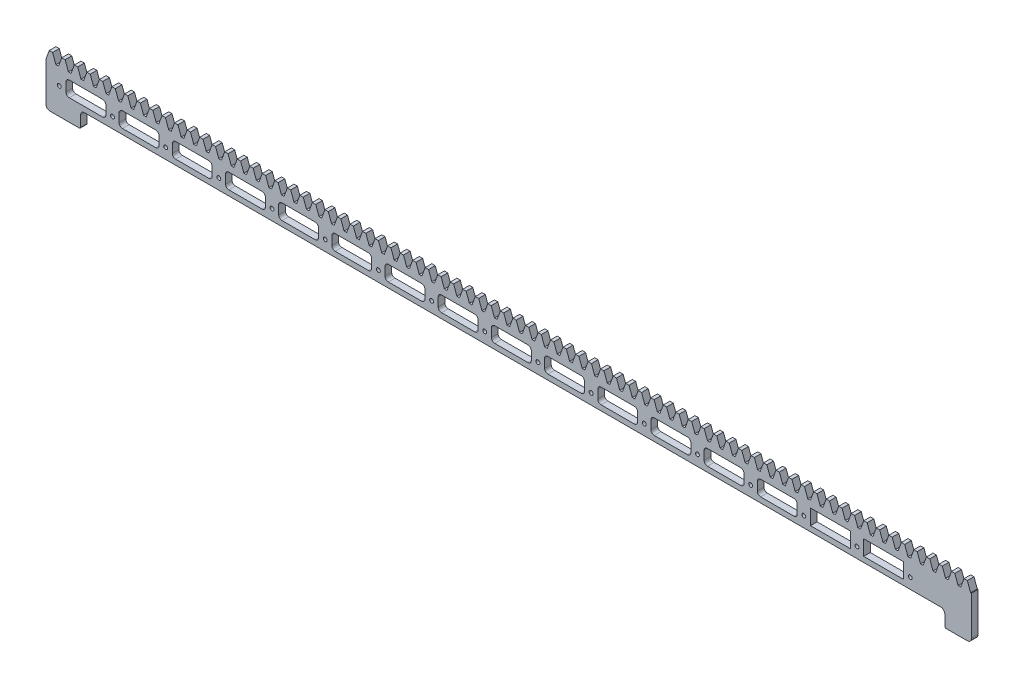
from build123d import *

# Parameters (mm, degrees)
SKETCH_1_W             = 695
SKETCH_1_H             = 20.5
EXTRUDE_1_DEPTH        = 5
EXTRUDE_2_DEPTH        = 5
PATTERN_LINEAR_1_COUNT = 74
PATTERN_LINEAR_1_PITCH = 9.42477795
SKETCH_3_R             = 1.45
CUT_EXTRUDE_1_DEPTH    = 696.770998472
CUT_EXTRUDE_START      = -10
SKETCH_5_R             = 1.45
CUT_EXTRUDE_2_DEPTH    = 10
SKETCH_10_W            = 30
SKETCH_10_H            = 11.5
CUT_EXTRUDE_4_DEPTH    = 696.770998472
FILLET_1_R             = 2.5
SKETCH_11_W            = 26
SKETCH_11_H            = 12
EXTRUDE_1_2_DEPTH      = 5
SKETCH_12_W            = 20
SKETCH_12_H            = 32.5
EXTRUDE_2_2_DEPTH      = 5
FILLET_2_R             = 3
FILLET_3_R             = 1
CUT_EXTRUDE_3_DEPTH    = 2


with BuildPart() as part:
    # 草图1 → Extrude 1 (new body)
    with BuildSketch(Plane.XY):
        with Locations((347.5, -10.25)):
            Rectangle(SKETCH_1_W, SKETCH_1_H)
    extrude(amount=EXTRUDE_1_DEPTH)

    # 草图2 → Extrude 2 (add)
    with BuildSketch(Plane.XY.offset(5)):
        Polygon((0, 0), (2.456799081, 6.75), (4.985366651, 6.75), (7.442165732, 0), align=None)
    extrude_2 = extrude(amount=-EXTRUDE_2_DEPTH)

    # 阵列(线性)1: Extrude 2 ×74
    with Locations(*[(i * PATTERN_LINEAR_1_PITCH, 0, 0) for i in range(1, PATTERN_LINEAR_1_COUNT)]):
        add(extrude_2)

    # 草图3 → 切除-拉伸1 (cut, through all)
    with BuildSketch(Plane.XY):
        with Locations((10, -12.5)):
            Circle(SKETCH_3_R)
    extrude(amount=CUT_EXTRUDE_1_DEPTH, mode=Mode.SUBTRACT)

    # 草图5 → 切除-拉伸2 (cut)
    with BuildSketch(Plane.XY.offset(5).offset(CUT_EXTRUDE_START)):
        with Locations((10, -12.5)):
            Circle(SKETCH_5_R)
        with Locations((50, -12.5)):
            Circle(SKETCH_5_R)
        with Locations((90, -12.5)):
            Circle(SKETCH_5_R)
        with Locations((130, -12.5)):
            Circle(SKETCH_5_R)
        with Locations((170, -12.5)):
            Circle(SKETCH_5_R)
        with Locations((210, -12.5)):
            Circle(SKETCH_5_R)
        with Locations((250, -12.5)):
            Circle(SKETCH_5_R)
        with Locations((290, -12.5)):
            Circle(SKETCH_5_R)
        with Locations((330, -12.5)):
            Circle(SKETCH_5_R)
        with Locations((370, -12.5)):
            Circle(SKETCH_5_R)
        with Locations((410, -12.5)):
            Circle(SKETCH_5_R)
        with Locations((450, -12.5)):
            Circle(SKETCH_5_R)
        with Locations((490, -12.5)):
            Circle(SKETCH_5_R)
        with Locations((530, -12.5)):
            Circle(SKETCH_5_R)
        with Locations((570, -12.5)):
            Circle(SKETCH_5_R)
        with Locations((610, -12.5)):
            Circle(SKETCH_5_R)
        with Locations((650, -12.5)):
            Circle(SKETCH_5_R)
    extrude(amount=CUT_EXTRUDE_2_DEPTH, mode=Mode.SUBTRACT)

    # 草图10 → 切除-拉伸4 (cut, through all)
    with BuildSketch(Plane.XY.offset(5)):
        with Locations((30, -10.75)):
            Rectangle(SKETCH_10_W, SKETCH_10_H)
        with Locations((70, -10.75)):
            Rectangle(SKETCH_10_W, SKETCH_10_H)
        with Locations((110, -10.75)):
            Rectangle(SKETCH_10_W, SKETCH_10_H)
        with Locations((150, -10.75)):
            Rectangle(SKETCH_10_W, SKETCH_10_H)
        with Locations((190, -10.75)):
            Rectangle(SKETCH_10_W, SKETCH_10_H)
        with Locations((230, -10.75)):
            Rectangle(SKETCH_10_W, SKETCH_10_H)
        with Locations((270, -10.75)):
            Rectangle(SKETCH_10_W, SKETCH_10_H)
        with Locations((310, -10.75)):
            Rectangle(SKETCH_10_W, SKETCH_10_H)
        with Locations((350, -10.75)):
            Rectangle(SKETCH_10_W, SKETCH_10_H)
        with Locations((390, -10.75)):
            Rectangle(SKETCH_10_W, SKETCH_10_H)
        with Locations((430, -10.75)):
            Rectangle(SKETCH_10_W, SKETCH_10_H)
        with Locations((470, -10.75)):
            Rectangle(SKETCH_10_W, SKETCH_10_H)
        with Locations((510, -10.75)):
            Rectangle(SKETCH_10_W, SKETCH_10_H)
        with Locations((550, -10.75)):
            Rectangle(SKETCH_10_W, SKETCH_10_H)
        with Locations((590, -10.75)):
            Rectangle(SKETCH_10_W, SKETCH_10_H)
        with Locations((630, -10.75)):
            Rectangle(SKETCH_10_W, SKETCH_10_H)
    extrude(amount=-CUT_EXTRUDE_4_DEPTH, mode=Mode.SUBTRACT)

    # 圆角1
    fillet_1_edges = [part.edges().sort_by_distance(p)[0] for p in [
        (15, -16.5, 2.5),
        (15, -5, 2.5),
        (45, -5, 2.5),
        (45, -16.5, 2.5),
        (55, -16.5, 2.5),
        (55, -5, 2.5),
        (85, -5, 2.5),
        (85, -16.5, 2.5),
        (95, -16.5, 2.5),
        (95, -5, 2.5),
        (125, -5, 2.5),
        (125, -16.5, 2.5),
        (135, -16.5, 2.5),
        (135, -5, 2.5),
        (165, -5, 2.5),
        (165, -16.5, 2.5),
        (175, -16.5, 2.5),
        (175, -5, 2.5),
        (205, -5, 2.5),
        (205, -16.5, 2.5),
        (215, -16.5, 2.5),
        (215, -5, 2.5),
        (245, -5, 2.5),
        (245, -16.5, 2.5),
        (255, -16.5, 2.5),
        (255, -5, 2.5),
        (285, -5, 2.5),
        (285, -16.5, 2.5),
        (295, -16.5, 2.5),
        (295, -5, 2.5),
        (325, -5, 2.5),
        (325, -16.5, 2.5),
        (335, -16.5, 2.5),
        (335, -5, 2.5),
        (365, -5, 2.5),
        (365, -16.5, 2.5),
        (375, -16.5, 2.5),
        (375, -5, 2.5),
        (405, -5, 2.5),
        (405, -16.5, 2.5),
        (415, -16.5, 2.5),
        (415, -5, 2.5),
        (445, -5, 2.5),
        (445, -16.5, 2.5),
        (455, -16.5, 2.5),
        (455, -5, 2.5),
        (485, -5, 2.5),
        (485, -16.5, 2.5),
        (495, -16.5, 2.5),
        (495, -5, 2.5),
        (525, -5, 2.5),
        (525, -16.5, 2.5),
        (535, -16.5, 2.5),
        (535, -5, 2.5),
        (565, -5, 2.5),
        (565, -16.5, 2.5),
    ]]
    fillet(fillet_1_edges, radius=FILLET_1_R)

    # 草图11 → Extrude 1 2 (add)
    with BuildSketch(Plane.XY):
        with Locations((13, -26.5)):
            Rectangle(SKETCH_11_W, SKETCH_11_H)
    extrude(amount=EXTRUDE_1_2_DEPTH)

    # 草图12 → Extrude 2 2 (add)
    with BuildSketch(Plane.XY):
        with Locations((686, -16.25)):
            Rectangle(SKETCH_12_W, SKETCH_12_H)
    extrude(amount=EXTRUDE_2_2_DEPTH)

    # 圆角2
    fillet_2_edges = [part.edges().sort_by_distance(p)[0] for p in [
        (26, -20.5, 2.5),
        (0, -32.5, 2.5),
        (676, -20.5, 2.5),
        (696, -32.5, 2.5),
    ]]
    fillet(fillet_2_edges, radius=FILLET_2_R)

    # 圆角3
    fillet_3_edges = [part.edges().sort_by_distance(p)[0] for p in [
        (26, -32.5, 2.5),
        (676, -32.5, 2.5),
    ]]
    fillet(fillet_3_edges, radius=FILLET_3_R)

    # 草图6 → 切除-拉伸3 (cut)
    with BuildSketch(Plane.XY.offset(5)):
        with BuildLine():
            Line((6, -5.5), (14, -5.5))
            ThreePointArc((14, -5.5), (17, -8.5), (14, -11.5))
            Line((14, -11.5), (6, -11.5))
            ThreePointArc((6, -11.5), (3, -8.5), (6, -5.5))
        make_face()
        with BuildLine():
            Line((46, -5.5), (54, -5.5))
            ThreePointArc((54, -5.5), (57, -8.5), (54, -11.5))
            Line((54, -11.5), (46, -11.5))
            ThreePointArc((46, -11.5), (43, -8.5), (46, -5.5))
        make_face()
        with BuildLine():
            Line((86, -5.5), (94, -5.5))
            ThreePointArc((94, -5.5), (97, -8.5), (94, -11.5))
            Line((94, -11.5), (86, -11.5))
            ThreePointArc((86, -11.5), (83, -8.5), (86, -5.5))
        make_face()
        with BuildLine():
            Line((126, -5.5), (134, -5.5))
            ThreePointArc((134, -5.5), (137, -8.5), (134, -11.5))
            Line((134, -11.5), (126, -11.5))
            ThreePointArc((126, -11.5), (123, -8.5), (126, -5.5))
        make_face()
        with BuildLine():
            Line((166, -5.5), (174, -5.5))
            ThreePointArc((174, -5.5), (177, -8.5), (174, -11.5))
            Line((174, -11.5), (166, -11.5))
            ThreePointArc((166, -11.5), (163, -8.5), (166, -5.5))
        make_face()
        with BuildLine():
            Line((206, -5.5), (214, -5.5))
            ThreePointArc((214, -5.5), (217, -8.5), (214, -11.5))
            Line((214, -11.5), (206, -11.5))
            ThreePointArc((206, -11.5), (203, -8.5), (206, -5.5))
        make_face()
        with BuildLine():
            Line((246, -5.5), (254, -5.5))
            ThreePointArc((254, -5.5), (257, -8.5), (254, -11.5))
            Line((254, -11.5), (246, -11.5))
            ThreePointArc((246, -11.5), (243, -8.5), (246, -5.5))
        make_face()
        with BuildLine():
            Line((286, -5.5), (294, -5.5))
            ThreePointArc((294, -5.5), (297, -8.5), (294, -11.5))
            Line((294, -11.5), (286, -11.5))
            ThreePointArc((286, -11.5), (283, -8.5), (286, -5.5))
        make_face()
        with BuildLine():
            Line((326, -5.5), (334, -5.5))
            ThreePointArc((334, -5.5), (337, -8.5), (334, -11.5))
            Line((334, -11.5), (326, -11.5))
            ThreePointArc((326, -11.5), (323, -8.5), (326, -5.5))
        make_face()
        with BuildLine():
            Line((366, -5.5), (374, -5.5))
            ThreePointArc((374, -5.5), (377, -8.5), (374, -11.5))
            Line((374, -11.5), (366, -11.5))
            ThreePointArc((366, -11.5), (363, -8.5), (366, -5.5))
        make_face()
        with BuildLine():
            Line((406, -5.5), (414, -5.5))
            ThreePointArc((414, -5.5), (417, -8.5), (414, -11.5))
            Line((414, -11.5), (406, -11.5))
            ThreePointArc((406, -11.5), (403, -8.5), (406, -5.5))
        make_face()
        with BuildLine():
            Line((446, -5.5), (454, -5.5))
            ThreePointArc((454, -5.5), (457, -8.5), (454, -11.5))
            Line((454, -11.5), (446, -11.5))
            ThreePointArc((446, -11.5), (443, -8.5), (446, -5.5))
        make_face()
        with BuildLine():
            Line((486, -5.5), (494, -5.5))
            ThreePointArc((494, -5.5), (497, -8.5), (494, -11.5))
            Line((494, -11.5), (486, -11.5))
            ThreePointArc((486, -11.5), (483, -8.5), (486, -5.5))
        make_face()
        with BuildLine():
            Line((526, -5.5), (534, -5.5))
            ThreePointArc((534, -5.5), (537, -8.5), (534, -11.5))
            Line((534, -11.5), (526, -11.5))
            ThreePointArc((526, -11.5), (523, -8.5), (526, -5.5))
        make_face()
        with BuildLine():
            Line((566, -5.5), (574, -5.5))
            ThreePointArc((574, -5.5), (577, -8.5), (574, -11.5))
            Line((574, -11.5), (566, -11.5))
            ThreePointArc((566, -11.5), (563, -8.5), (566, -5.5))
        make_face()
    extrude(amount=CUT_EXTRUDE_3_DEPTH, mode=Mode.SUBTRACT)


solid = part.part
